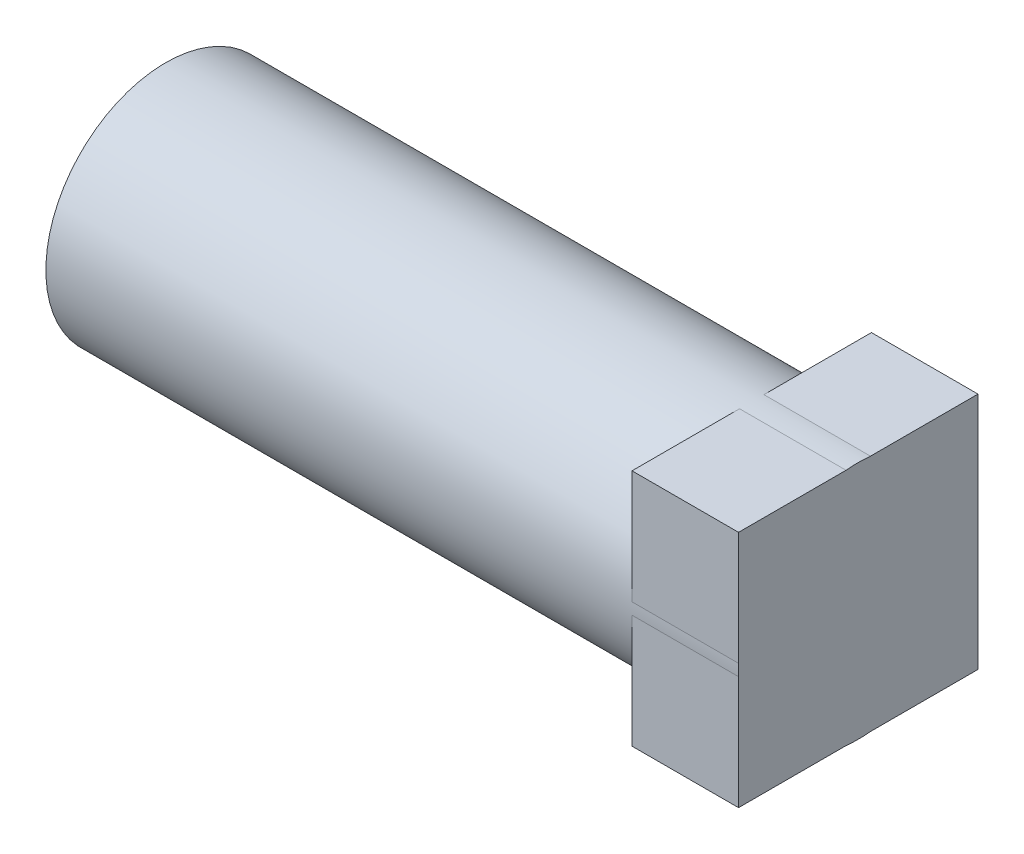
from build123d import *

# Parameters (mm, degrees)
SKETCH1_R           = 2.25
BOSS_EXTRUDE1_DEPTH = 13
SKETCH2_W           = 4.494767916
SKETCH2_H           = 4.476575264
BOSS_EXTRUDE2_DEPTH = 2


with BuildPart() as part:
    # Sketch1 → Boss-Extrude1 (new body)
    with BuildSketch(Plane(origin=(0, 0, 0), x_dir=(0, 0, -1), z_dir=(1, 0, 0))):
        Circle(SKETCH1_R)
    extrude(amount=BOSS_EXTRUDE1_DEPTH)

    # Sketch2 → Boss-Extrude2 (add)
    with BuildSketch(Plane(origin=(13, 0, 0), x_dir=(0, 0, -1), z_dir=(1, 0, 0))):
        Rectangle(SKETCH2_W, SKETCH2_H)
    extrude(amount=-BOSS_EXTRUDE2_DEPTH)


solid = part.part
